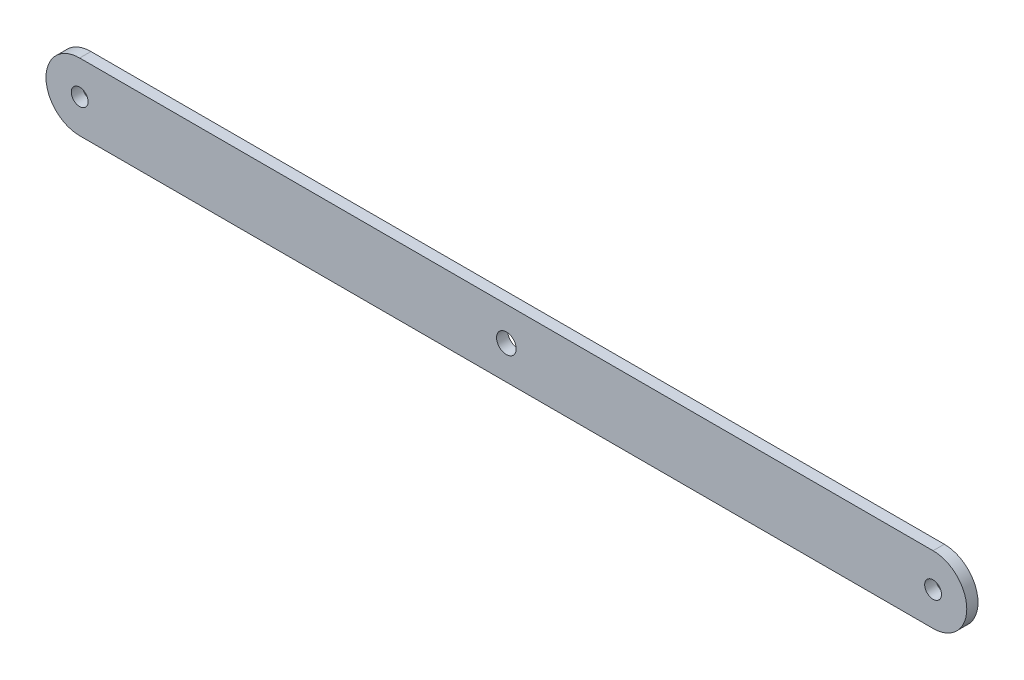
from build123d import *

# Parameters (mm, degrees)
SKETCH1_R           = 1.5
SKETCH1_R_2         = 1.75
BOSS_EXTRUDE1_DEPTH = 2


with BuildPart() as part:
    # Sketch1 → Boss-Extrude1 (new body)
    with BuildSketch(Plane.XY):
        with BuildLine():
            Line((-76, 6), (76, 6))
            ThreePointArc((76, 6), (82, 0), (76, -6))
            Line((76, -6), (-76, -6))
            ThreePointArc((-76, -6), (-82, 0), (-76, 6))
        make_face()
        with Locations((-76, 0)):
            Circle(SKETCH1_R, mode=Mode.SUBTRACT)
        Circle(SKETCH1_R_2, mode=Mode.SUBTRACT)
        with Locations((76, 0)):
            Circle(SKETCH1_R, mode=Mode.SUBTRACT)
    extrude(amount=BOSS_EXTRUDE1_DEPTH)


solid = part.part
